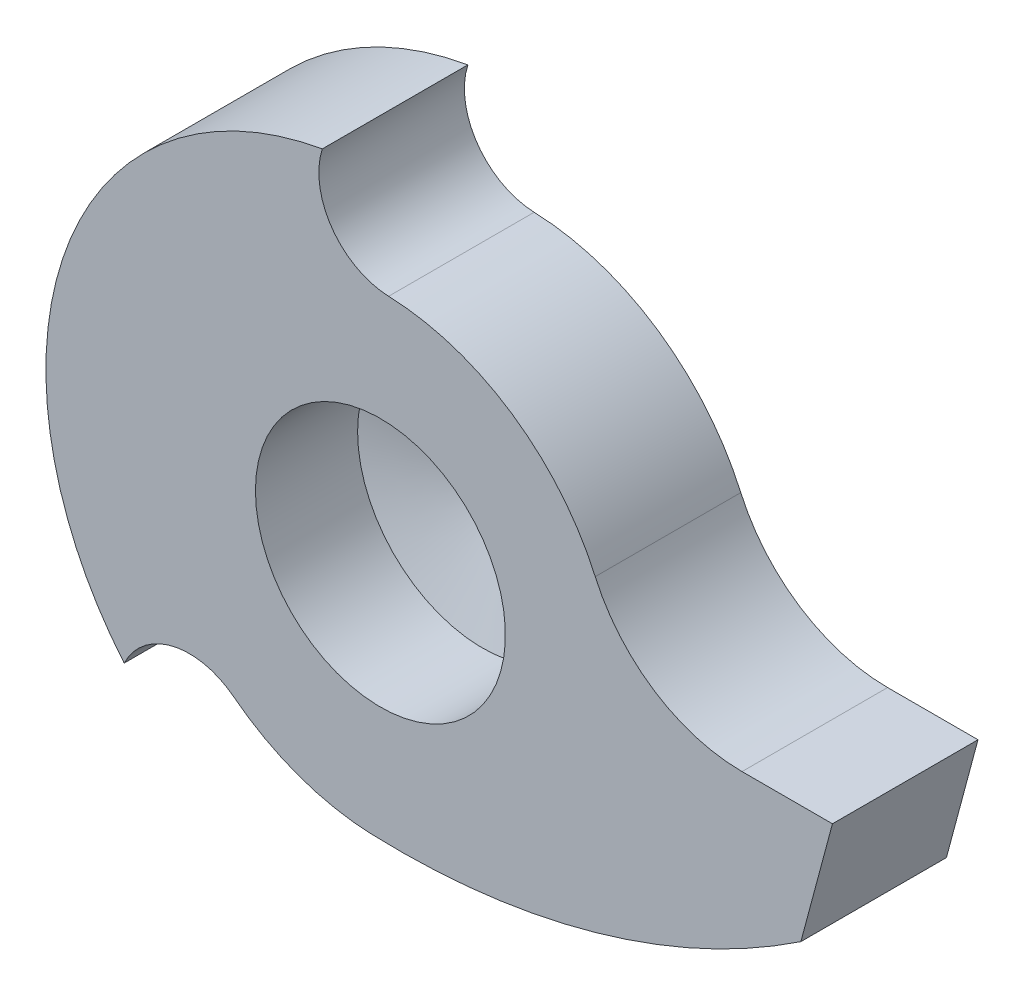
from build123d import *

# Parameters (mm, degrees)
BOSS_EXTRUDE1_DEPTH = 16.1


with BuildPart() as part:
    # Sketch1 → Boss-Extrude1 (new body)
    with BuildSketch(Plane.XY):
        with BuildLine():
            Line((50, 0), (40, 0))
            ThreePointArc((40, 0), (30.315976232, 2.870732664), (23.760984183, 10.555360281))
            ThreePointArc((23.760984183, 10.555360281), (14.548392123, 21.548649299), (0.908348668, 25.9841279))
            ThreePointArc((0.908348668, 25.9841279), (-5.361390555, 29.384946435), (-6.424982574, 36.437886861))
            ThreePointArc((-6.424982574, 36.437886861), (-34.768626969, 12.654745303), (-28.343644395, -23.783141558))
            ThreePointArc((-28.343644395, -23.783141558), (-22.968628382, -19.475636074), (-16.238437284, -20.941899498))
            ThreePointArc((-16.238437284, -20.941899498), (-9.057238023, -24.904145024), (-1.008439677, -26.480805302))
            ThreePointArc((-1.008439677, -26.480805302), (23.811713564, -23.518061947), (46.505942891, -13.039998655))
            Line((46.505942891, -13.039998655), (50, 0))
        make_face()
    extrude(amount=BOSS_EXTRUDE1_DEPTH)

    # Sketch2 → Cut-Revolve1 (revolve, cut)
    with BuildSketch(Plane(origin=(0, 0, 0), x_dir=(1, 0, 0), z_dir=(0, 1, 0))):
        Polygon((13.825, -16.1), (13.825, -4.8), (5, -2.2), (2.75, -2.2), (2.75, 0), (0, 0), (0, -16.1), align=None)
    revolve(axis=Axis((0, 0, 0), (0, 0, 1)), mode=Mode.SUBTRACT)


solid = part.part
